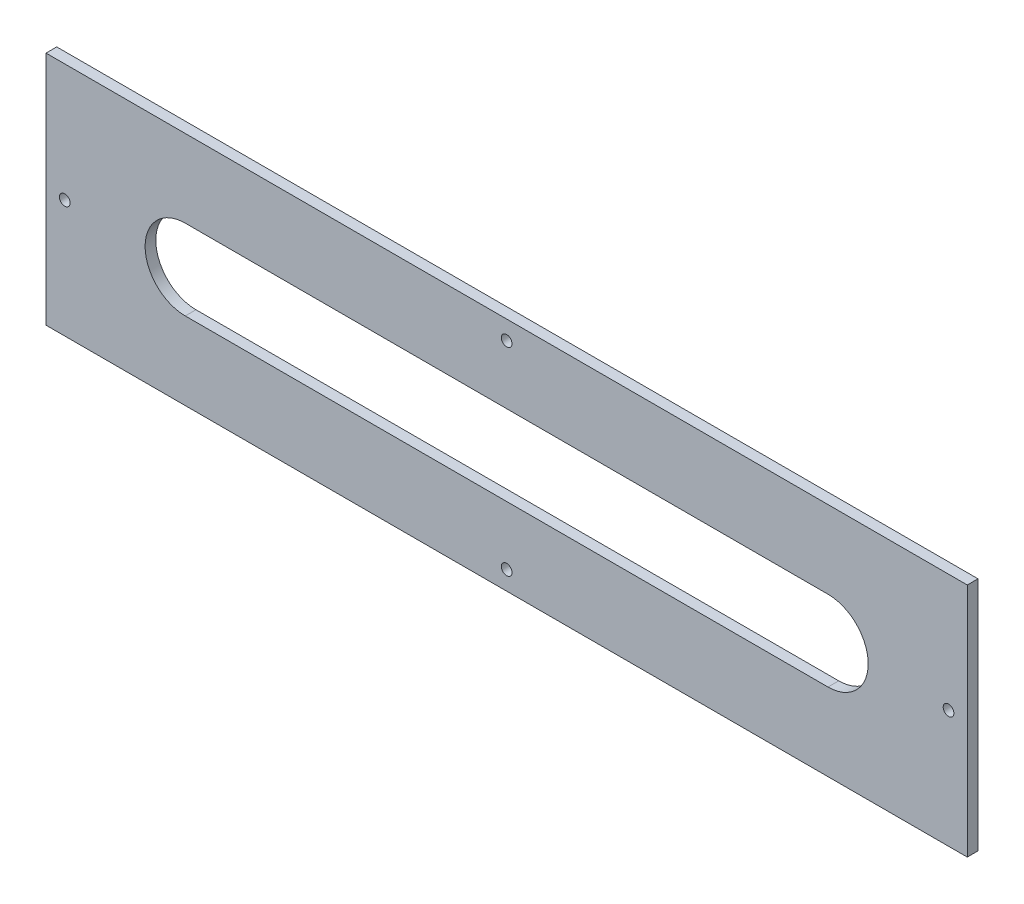
from build123d import *

# Parameters (mm, degrees)
SCHIZZO1_W                   = 344
SCHIZZO1_H                   = 88
SCHIZZO1_R                   = 2
ESTRUSIONE_ESTRUSIONE1_DEPTH = 4


with BuildPart() as part:
    # Schizzo1 → Estrusione-Estrusione1 (new body)
    with BuildSketch(Plane.XY):
        with Locations((-172, 44)):
            Rectangle(SCHIZZO1_W, SCHIZZO1_H)
        with Locations((-7, 44)):
            Circle(SCHIZZO1_R, mode=Mode.SUBTRACT)
        with Locations((-172, 81)):
            Circle(SCHIZZO1_R, mode=Mode.SUBTRACT)
        with Locations((-337, 44)):
            Circle(SCHIZZO1_R, mode=Mode.SUBTRACT)
        with Locations((-172, 7)):
            Circle(SCHIZZO1_R, mode=Mode.SUBTRACT)
        with BuildLine():
            Line((-292, 59), (-52, 59))
            ThreePointArc((-52, 59), (-37, 44), (-52, 29))
            Line((-52, 29), (-292, 29))
            ThreePointArc((-292, 29), (-307, 44), (-292, 59))
        make_face(mode=Mode.SUBTRACT)
    extrude(amount=ESTRUSIONE_ESTRUSIONE1_DEPTH)


solid = part.part
